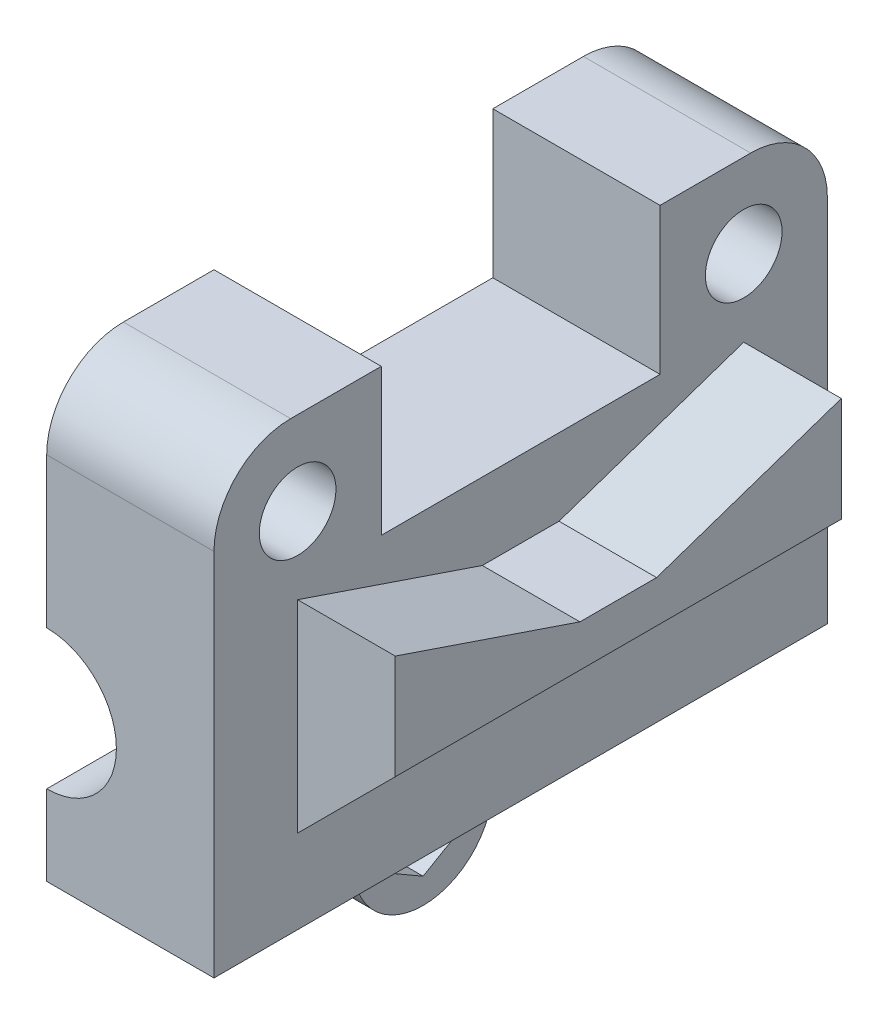
from build123d import *

# Parameters (mm, degrees)
SKETCH1_W               = 44
SKETCH1_H               = 32
BOSS_EXTRUDE1_DEPTH     = 12
SKETCH2_W               = 24.5
SKETCH2_H               = 15.5
CUT_EXTRUDE1_DEPTH      = 7.75
FILLET1_R               = 7.75
CUT_EXTRUDE2_DEPTH      = 40.661851949
CUT_EXTRUDE2_DEPTH_BACK = 40.661851949
SKETCH4_R               = 2.75
SKETCH4_W               = 20
SKETCH4_H               = 10.5
CUT_EXTRUDE3_DEPTH      = 30.732137495
SKETCH5_W               = 5.5
SKETCH5_H               = 3
BOSS_EXTRUDE4_DEPTH     = 7
CHAMFER1_SIZE           = 7
SKETCH6_W               = 11.5
SKETCH6_H               = 7
CUT_EXTRUDE5_DEPTH      = 30.732137495
FILLET4_R               = 5.5
SKETCH7_W               = 10
SKETCH7_H               = 10
SKETCH7_R               = 2
BOSS_EXTRUDE5_DEPTH     = 5
CUT_EXTRUDE6_START      = -2
SKETCH8_R               = 2
CUT_EXTRUDE6_DEPTH      = 2
FILLET5_R               = 5
CUT_EXTRUDE7_START      = -4
SKETCH9_R               = 2.75
CUT_EXTRUDE7_DEPTH      = 4


with BuildPart() as part:
    # Sketch1 → Boss-Extrude1 (new body)
    with BuildSketch(Plane(origin=(0, 0, 0), x_dir=(0, 0, -1), z_dir=(1, 0, 0))):
        Rectangle(SKETCH1_W, SKETCH1_H)
    extrude(amount=BOSS_EXTRUDE1_DEPTH)

    # Sketch2 → Cut-Extrude1 (cut)
    with BuildSketch(Plane(origin=(0, 0, 0), x_dir=(0, 0, -1), z_dir=(1, 0, 0))):
        with Locations((0, -5.25)):
            Rectangle(SKETCH2_W, SKETCH2_H)
    extrude(amount=CUT_EXTRUDE1_DEPTH, mode=Mode.SUBTRACT)

    # Fillet1
    fillet1_edges = [part.edges().sort_by_distance(p)[0] for p in [
        (7.75, 2.5, 0),
        (7.75, -13, 0),
    ]]
    fillet(fillet1_edges, radius=FILLET1_R - 0.0001)  # a hair under: the kernel refuses the full size

    # Sketch3 → Cut-Extrude2 (cut, two sides: drawn at the far end of the back side and taken through both)
    with BuildSketch(Plane.XY.offset(-12.25).offset(-CUT_EXTRUDE2_DEPTH_BACK)):
        with BuildLine():
            ThreePointArc((0, -10.25), (3.535533906, -8.785533906), (5, -5.25))
            ThreePointArc((5, -5.25), (3.535533906, -1.714466094), (0, -0.25))
            Line((0, -0.25), (0, -10.25))
        make_face()
        with BuildLine():
            Line((0, -10.25), (0, -0.25))
            ThreePointArc((0, -0.25), (-5, -5.25), (0, -10.25))
        make_face()
    extrude(amount=CUT_EXTRUDE2_DEPTH + CUT_EXTRUDE2_DEPTH_BACK, mode=Mode.SUBTRACT)

    # Sketch4 → Cut-Extrude3 (cut, through all)
    with BuildSketch(Plane(origin=(12, 0, 0), x_dir=(0, 0, -1), z_dir=(1, 0, 0))):
        with Locations((-16, 10)):
            Circle(SKETCH4_R)
        with Locations((16, 10)):
            Circle(SKETCH4_R)
        with Locations((0, 10.75)):
            Rectangle(SKETCH4_W, SKETCH4_H)
    extrude(amount=-CUT_EXTRUDE3_DEPTH, mode=Mode.SUBTRACT)

    # Sketch5 → Boss-Extrude4 (add)
    with BuildSketch(Plane(origin=(12, 0, 0), x_dir=(0, 0, -1), z_dir=(1, 0, 0))):
        Polygon((-16, -3), (-16, 4.5), (-2.75, -3), align=None)
        Polygon((-2.75, -3), (-16, 4.5), (-2.75, 0), align=None)
        with Locations((0, -1.5)):
            Rectangle(SKETCH5_W, SKETCH5_H)
        Polygon((2.75, -3), (2.75, 0), (16, 4.5), align=None)
        Polygon((16, -3), (2.75, -3), (16, 4.5), align=None)
    extrude(amount=BOSS_EXTRUDE4_DEPTH)

    # Chamfer1
    chamfer1_edges = [part.edges().sort_by_distance(p)[0] for p in [
        (12, -3, 0),
    ]]
    chamfer(chamfer1_edges, length=CHAMFER1_SIZE - 0.0001)  # a hair under: the kernel refuses the full size

    # Sketch6 → Cut-Extrude5 (cut, through all)
    with BuildSketch(Plane(origin=(12, 0, 0), x_dir=(0, 0, -1), z_dir=(1, 0, 0))):
        with Locations((-7.25, -6.5)):
            Rectangle(SKETCH6_W, SKETCH6_H)
        with Locations((7.25, -6.5)):
            Rectangle(SKETCH6_W, SKETCH6_H)
    extrude(amount=CUT_EXTRUDE5_DEPTH, mode=Mode.SUBTRACT)

    # Fillet4
    fillet4_edges = [part.edges().sort_by_distance(p)[0] for p in [
        (6, 16, 22),
        (6, 16, -22),
    ]]
    fillet(fillet4_edges, radius=FILLET4_R)

    # Sketch7 → Boss-Extrude5 (add)
    with BuildSketch(Plane(origin=(0, 0, 0), x_dir=(0, 0, -1), z_dir=(1, 0, 0))):
        with Locations((0, -21)):
            Rectangle(SKETCH7_W, SKETCH7_H)
        with Locations((0, -21)):
            Circle(SKETCH7_R, mode=Mode.SUBTRACT)
    extrude(amount=BOSS_EXTRUDE5_DEPTH)

    # Sketch8 → Cut-Extrude6 (cut)
    with BuildSketch(Plane(origin=(5, 0, 0), x_dir=(0, 0, -1), z_dir=(1, 0, 0)).offset(CUT_EXTRUDE6_START)):
        Polygon((0, -24.175426481), (2.75, -22.58771324), (2.75, -19.41228676), (0, -17.824573519), (-2.75, -19.41228676), (-2.75, -22.58771324), align=None)
        with Locations((0, -21)):
            Circle(SKETCH8_R, mode=Mode.SUBTRACT)
    extrude(amount=CUT_EXTRUDE6_DEPTH, mode=Mode.SUBTRACT)

    # Fillet5
    fillet5_edges = [part.edges().sort_by_distance(p)[0] for p in [
        (2.5, -26, -5),
        (2.5, -26, 5),
    ]]
    fillet(fillet5_edges, radius=FILLET5_R - 0.0001)  # a hair under: the kernel refuses the full size

    # Sketch9 → Cut-Extrude7 (cut)
    # profile 1 of 2: a face of its own
    with BuildSketch(Plane.ZY.offset(CUT_EXTRUDE7_START)):
        Polygon((-16, 5.381197846), (-12, 7.690598923), (-12, 12.309401077), (-16, 14.618802154), (-20, 12.309401077), (-20, 7.690598923), align=None)
        with Locations(Location((-16, 10, 0), (0, 0, 180))):
            Circle(SKETCH9_R, mode=Mode.SUBTRACT)
    # profile 2 of 2: a face of its own
    with BuildSketch(Plane.ZY.offset(CUT_EXTRUDE7_START)):
        Polygon((16, 5.381197846), (20, 7.690598923), (20, 12.309401077), (16, 14.618802154), (12, 12.309401077), (12, 7.690598923), align=None)
        with Locations(Location((16, 10, 0), (0, 0, 180))):
            Circle(SKETCH9_R, mode=Mode.SUBTRACT)
    extrude(amount=CUT_EXTRUDE7_DEPTH, mode=Mode.SUBTRACT)


solid = part.part
